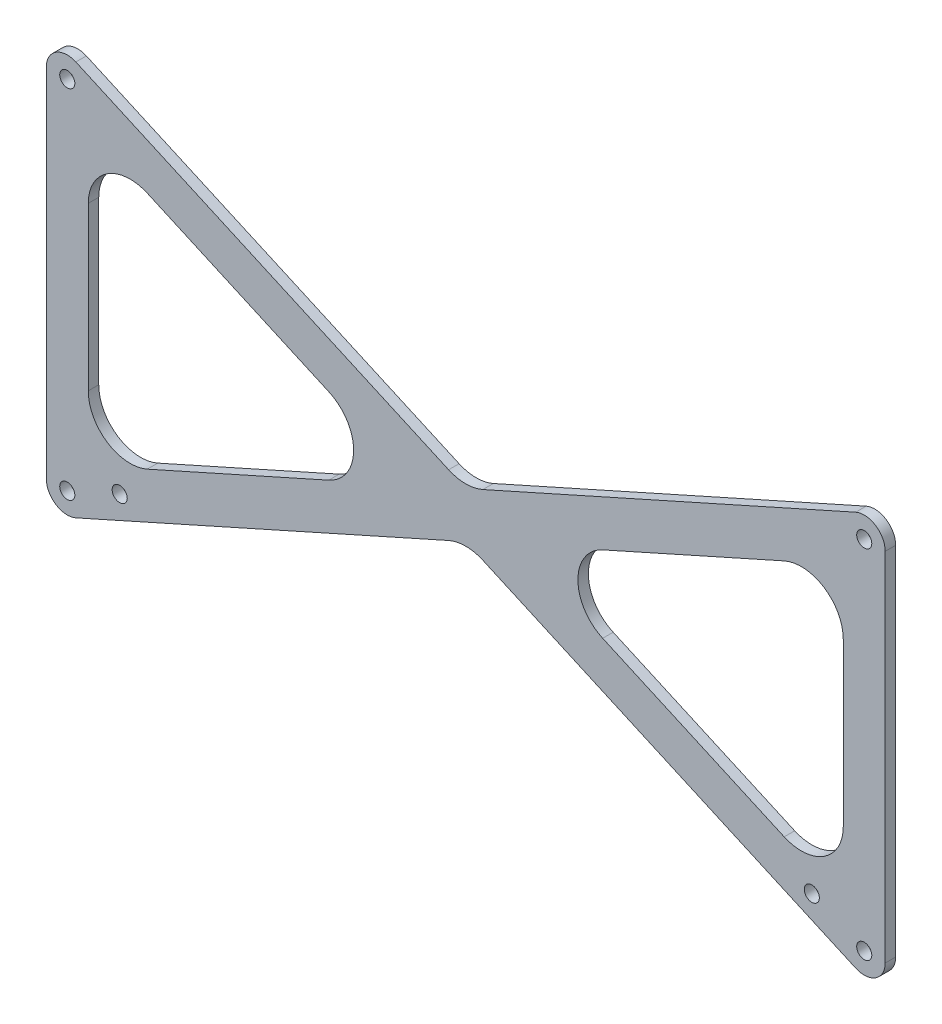
from build123d import *

# Parameters (mm, degrees)
BOSS_EXTRUDE1_DEPTH = 3.175
SKETCH2_R           = 2.286
CUT_EXTRUDE1_DEPTH  = 141.634939649
FILLET1_R           = 12.7


with BuildPart() as part:
    # Sketch1 → Boss-Extrude1 (new body)
    with BuildSketch(Plane.XY):
        with BuildLine():
            Line((-118.056875519, -59.7713959), (0, -6.956477904))
            Line((0, -6.956477904), (118.056875519, -59.7713959))
            ThreePointArc((118.056875519, -59.7713959), (124.103705224, -59.303641499), (127, -53.975))
            Line((127, -53.975), (127, 53.975))
            ThreePointArc((127, 53.975), (124.103705224, 59.303641499), (118.056875519, 59.7713959))
            Line((118.056875519, 59.7713959), (0, 6.956477904))
            Line((0, 6.956477904), (-118.056875519, 59.7713959))
            ThreePointArc((-118.056875519, 59.7713959), (-124.103705224, 59.303641499), (-127, 53.975))
            Line((-127, 53.975), (-127, -53.975))
            ThreePointArc((-127, -53.975), (-124.103705224, -59.303641499), (-118.056875519, -59.7713959))
        make_face()
        Polygon((-114.3, -44.177732622), (-15.549774139, 0), (-114.3, 44.177732622), align=None, mode=Mode.SUBTRACT)
        Polygon((15.549774139, 0), (114.3, 44.177732622), (114.3, -44.177732622), align=None, mode=Mode.SUBTRACT)
    extrude(amount=BOSS_EXTRUDE1_DEPTH)

    # Sketch2 → Cut-Extrude1 (cut, through all)
    with BuildSketch(Plane.XY.offset(3.175)):
        with Locations((-120.65, 53.975)):
            Circle(SKETCH2_R)
        with Locations((-120.65, -53.975)):
            Circle(SKETCH2_R)
        with Locations((120.65, -53.975)):
            Circle(SKETCH2_R)
        with Locations((120.65, 53.975)):
            Circle(SKETCH2_R)
        with Locations((104.775, -46.873026316)):
            Circle(SKETCH2_R)
        with Locations((-104.775, -46.873026316)):
            Circle(SKETCH2_R)
    extrude(amount=-CUT_EXTRUDE1_DEPTH, mode=Mode.SUBTRACT)

    # Fillet1
    fillet1_edges = [part.edges().sort_by_distance(p)[0] for p in [
        (114.3, -44.177732622, 1.5875),
        (114.3, 44.177732622, 1.5875),
        (15.549774139, 0, 1.5875),
        (-114.3, -44.177732622, 1.5875),
        (-15.549774139, 0, 1.5875),
        (-114.3, 44.177732622, 1.5875),
        (0, 6.956477904, 1.5875),
        (0, -6.956477904, 1.5875),
    ]]
    fillet(fillet1_edges, radius=FILLET1_R)


solid = part.part
